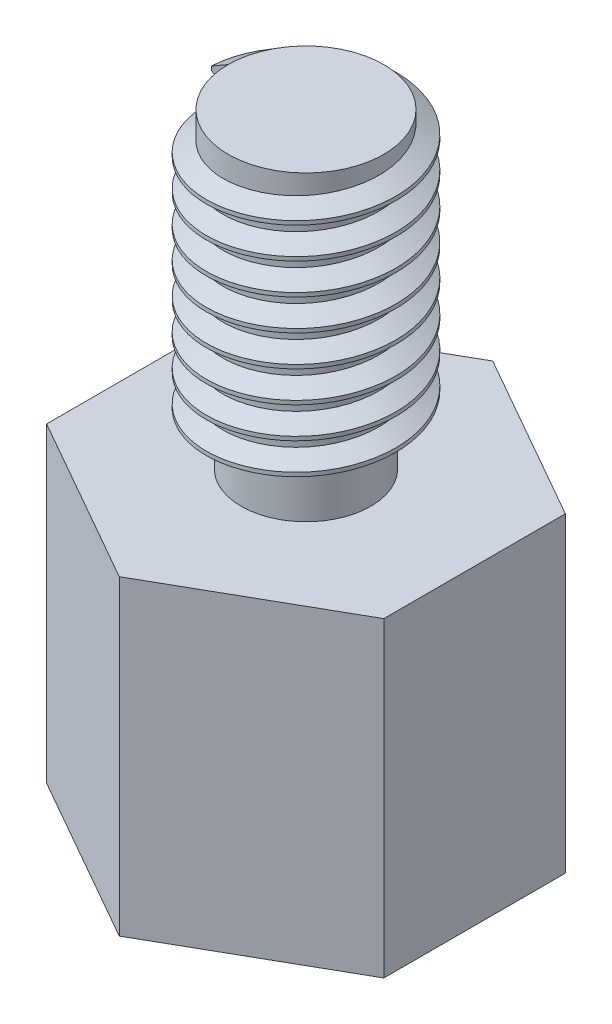
from build123d import *
from build123d.topology import SkipClean

# Parameters (mm, degrees)
BOSS_EXTRU_1_DEPTH      = 6
ESQUISSE2_R             = 1.5
ENL_V_MAT_EXTRU_1_DEPTH = 5
ESQUISSE3_R             = 1.25
BOSS_EXTRU_2_DEPTH      = 6
BOSS_EXTRU_3_START      = -5
ESQUISSE4_R             = 1.5
BOSS_EXTRU_3_DEPTH      = 5
FILETAGE1_PITCH         = 0.6
FILETAGE2_PITCH         = 0.6


with BuildPart() as part:
    # Esquisse1 → Boss.-Extru.1 (new body)
    with BuildSketch(Plane(origin=(0, 0, 0), x_dir=(1, 0, 0), z_dir=(0, 1, 0))):
        Polygon((-3.25, 1.75), (-3.25, -1.75), (0, -3.6), (3.25, -1.75), (3.25, 1.75), (0, 3.6), align=None)
    extrude(amount=BOSS_EXTRU_1_DEPTH)

    # Esquisse2 → Enlèv. mat.-Extru.1 (cut)
    with BuildSketch(Plane.XZ):
        with Locations(Location((0, 0, 0), (0, 0, 270))):
            Circle(ESQUISSE2_R)
    extrude(amount=-ENL_V_MAT_EXTRU_1_DEPTH, mode=Mode.SUBTRACT)

    # Esquisse3 → Boss.-Extru.2 (add)
    with BuildSketch(Plane(origin=(0, 6, 0), x_dir=(1, 0, 0), z_dir=(0, 1, 0))):
        with Locations(Location((0, 0, 0), (0, 0, 270))):
            Circle(ESQUISSE3_R)
    extrude(amount=BOSS_EXTRU_2_DEPTH)

    # Esquisse4 → Boss.-Extru.3 (add)
    with BuildSketch(Plane(origin=(0, 12, 0), x_dir=(1, 0, 0), z_dir=(0, 1, 0)).offset(BOSS_EXTRU_3_START)):
        with Locations(Location((0, 0, 0), (0, 0, 90))):
            Circle(ESQUISSE4_R)
    extrude(amount=BOSS_EXTRU_3_DEPTH)

    # Filetage1: the profile of Profil de filetage1 profile screwed along a right-hand helix of 8.333333 turns, 6 arcs to a turn; built about Z, then put on its axis
    filetage1_z = Axis((0, 0, 0), (0, 0, 1))
    filetage1_corners = [(1.4997, 0, -0.000173205), (1.824759525, 0, 0.187499999), (1.824759525, 0, 0.262499999), (1.4997, 0, 0.450173203)]
    with BuildLine(mode=Mode.PRIVATE) as filetage1_profile:
        Line(filetage1_corners[0], filetage1_corners[1])
        Line(filetage1_corners[1], filetage1_corners[2])
        Line(filetage1_corners[2], filetage1_corners[3])
        Line(filetage1_corners[3], filetage1_corners[0])
    filetage1_cap = Face(filetage1_profile.wire())
    filetage1_turn_angles = [0, 30, 60, 90, 120, 150, 180, 210, 240, 270, 300, 330, 360]
    filetage1_turn_weights = [1, 0.8660254037844387, 1, 0.8660254037844387, 1, 0.8660254037844387, 1, 0.8660254037844387, 1, 0.8660254037844387, 1, 0.8660254037844387, 1]
    filetage1_turn_rails = [Edge.make_bspline([Vector(p[0], p[1], 0).rotate(filetage1_z, filetage1_turn_angles[k]) / filetage1_turn_weights[k] + Vector(0, 0, p[2] + FILETAGE1_PITCH * filetage1_turn_angles[k] / 360) for k in range(13)], [0, 0, 0, 1, 1, 2, 2, 3, 3, 4, 4, 5, 5, 6, 6, 6], 2, filetage1_turn_weights) for p in filetage1_corners]
    filetage1_turn_sides = [Face.make_surface_from_curves(filetage1_turn_rails[p[0]], filetage1_turn_rails[p[1]]) for p in [(0, 1), (1, 2), (2, 3), (3, 0)]]
    filetage1_last_angles = [2880, 2910, 2940, 2969.9999718, 2999.9999436]
    filetage1_last_weights = [1, 0.8660254037844387, 1, 0.866025649875759, 1]
    filetage1_last_rails = [Edge.make_bspline([Vector(p[0], p[1], 0).rotate(filetage1_z, filetage1_last_angles[k]) / filetage1_last_weights[k] + Vector(0, 0, p[2] + FILETAGE1_PITCH * filetage1_last_angles[k] / 360) for k in range(5)], [0, 0, 0, 1, 1, 2, 2, 2], 2, filetage1_last_weights) for p in filetage1_corners]
    filetage1_last_sides = [Face.make_surface_from_curves(filetage1_last_rails[p[0]], filetage1_last_rails[p[1]]) for p in [(0, 1), (1, 2), (2, 3), (3, 0)]]
    filetage1 = Plane(origin=(0, 12, 0), x_dir=(-1, 0, 0), z_dir=(0, -1, 0)) * Solid(Shell([*[p.moved(Location((0, 0, FILETAGE1_PITCH * i))) for i in range(8) for p in filetage1_turn_sides], *filetage1_last_sides, filetage1_cap, filetage1_cap.rotate(filetage1_z, 2999.9999436).moved(Location((0, 0, FILETAGE1_PITCH * 2999.9999436 / 360)))]))
    add(filetage1)

    # Filetage2: the profile of Profil de filetage2 profile screwed along a right-hand helix of 8.333333 turns, 6 arcs to a turn; built about Z, then put on its axis
    with SkipClean():  # the faces are left unmerged after this step: merging them gives an invalid solid
        filetage2_z = Axis((0, 0, 0), (0, 0, 1))
        filetage2_corners = [(1.4997, 0, -0.000173205), (1.824759525, 0, 0.187499999), (1.824759525, 0, 0.262499999), (1.4997, 0, 0.450173203)]
        with BuildLine(mode=Mode.PRIVATE) as filetage2_profile:
            Line(filetage2_corners[0], filetage2_corners[1])
            Line(filetage2_corners[1], filetage2_corners[2])
            Line(filetage2_corners[2], filetage2_corners[3])
            Line(filetage2_corners[3], filetage2_corners[0])
        filetage2_cap = Face(filetage2_profile.wire())
        filetage2_turn_angles = [0, 30, 60, 90, 120, 150, 180, 210, 240, 270, 300, 330, 360]
        filetage2_turn_weights = [1, 0.8660254037844387, 1, 0.8660254037844387, 1, 0.8660254037844387, 1, 0.8660254037844387, 1, 0.8660254037844387, 1, 0.8660254037844387, 1]
        filetage2_turn_rails = [Edge.make_bspline([Vector(p[0], p[1], 0).rotate(filetage2_z, filetage2_turn_angles[k]) / filetage2_turn_weights[k] + Vector(0, 0, p[2] + FILETAGE2_PITCH * filetage2_turn_angles[k] / 360) for k in range(13)], [0, 0, 0, 1, 1, 2, 2, 3, 3, 4, 4, 5, 5, 6, 6, 6], 2, filetage2_turn_weights) for p in filetage2_corners]
        filetage2_turn_sides = [Face.make_surface_from_curves(filetage2_turn_rails[p[0]], filetage2_turn_rails[p[1]]) for p in [(0, 1), (1, 2), (2, 3), (3, 0)]]
        filetage2_last_angles = [2880, 2910, 2940, 2969.9999718, 2999.9999436]
        filetage2_last_weights = [1, 0.8660254037844387, 1, 0.866025649875759, 1]
        filetage2_last_rails = [Edge.make_bspline([Vector(p[0], p[1], 0).rotate(filetage2_z, filetage2_last_angles[k]) / filetage2_last_weights[k] + Vector(0, 0, p[2] + FILETAGE2_PITCH * filetage2_last_angles[k] / 360) for k in range(5)], [0, 0, 0, 1, 1, 2, 2, 2], 2, filetage2_last_weights) for p in filetage2_corners]
        filetage2_last_sides = [Face.make_surface_from_curves(filetage2_last_rails[p[0]], filetage2_last_rails[p[1]]) for p in [(0, 1), (1, 2), (2, 3), (3, 0)]]
        filetage2 = Plane(origin=(0, 0, 0), x_dir=(1, 0, 0), z_dir=(0, 1, 0)) * Solid(Shell([*[p.moved(Location((0, 0, FILETAGE2_PITCH * i))) for i in range(8) for p in filetage2_turn_sides], *filetage2_last_sides, filetage2_cap, filetage2_cap.rotate(filetage2_z, 2999.9999436).moved(Location((0, 0, FILETAGE2_PITCH * 2999.9999436 / 360)))]))
        add(filetage2, mode=Mode.SUBTRACT)


solid = part.part
